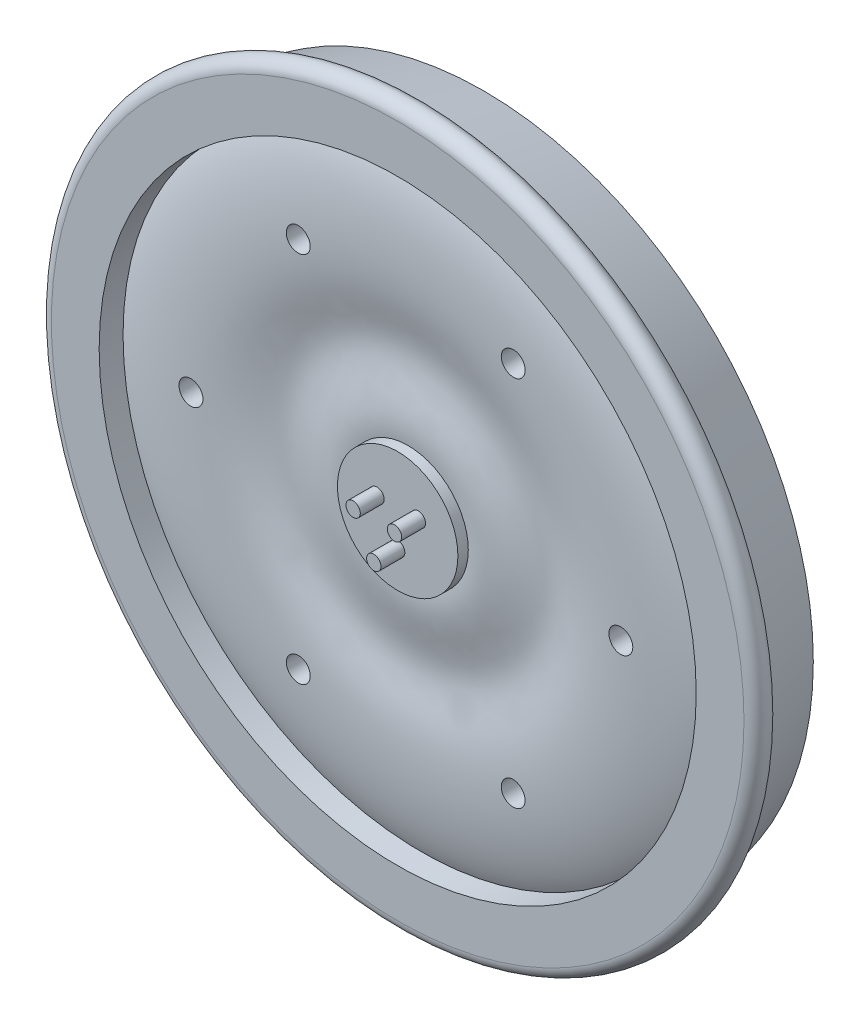
from build123d import *

# Parameters (mm, degrees)
SKETCH1_R           = 750
SKETCH1_R_2         = 625
BOSS_EXTRUDE1_DEPTH = 50
FILLET1_R           = 25
SKETCH6_R           = 126.083182062
BOSS_EXTRUDE3_DEPTH = 50
SKETCH8_R           = 15
BOSS_EXTRUDE4_DEPTH = 50
CIRPATTERN1_COUNT   = 3
SKETCH9_W           = 12.905989232
SKETCH9_H           = 4
BOSS_EXTRUDE5_DEPTH = 8
CIRPATTERN2_COUNT   = 9
SKETCH10_W          = 45.282032302
SKETCH10_H          = 16
BOSS_EXTRUDE6_DEPTH = 10
CIRPATTERN3_COUNT   = 6
CUT_EXTRUDE1_REACH  = 1087.311
SKETCH11_R          = 25
CIRPATTERN4_COUNT   = 3


with BuildPart() as part:
    # Sketch1 → Boss-Extrude1 (new body)
    with BuildSketch(Plane.XY):
        Circle(SKETCH1_R)
        Circle(SKETCH1_R_2, mode=Mode.SUBTRACT)
    extrude(amount=BOSS_EXTRUDE1_DEPTH)

    # Fillet1
    fillet1_edges = [part.edges().sort_by_distance(p)[0] for p in [
        (-750, 0, 0),
        (-750, 0, 50),
    ]]
    fillet(fillet1_edges, radius=FILLET1_R - 0.0001)  # a hair under: the kernel refuses the full size

    # Sketch4 → Revolve2 (revolve)
    with BuildSketch(Plane(origin=(0, 0, 0), x_dir=(0, 0, -1), z_dir=(1, 0, 0))):
        with BuildLine():
            Line((0, 0), (0, 725))
            Line((0, 725), (130, 690.166604984))
            Line((130, 690.166604984), (130, 540.166604984))
            Line((130, 540.166604984), (100.005783174, 540.166604984))
            add(Edge.make_bspline(
                [(100.005783174, 540.166604984), (96.198999511, 512.609594068), (86.026369645, 445.238818447), (114.230387903, 352.883317745), (111.02102964, 268.940515239), (91.251843551, 235.11912262), (100.273716459, 161.686724431), (105.684554179, 140.642715603)],
                knots=[0.05114988, 0.05114988, 0.05114988, 0.05114988, 0.227446797, 0.329786864, 0.370281134, 0.632389501, 0.754577815, 0.754577815, 0.754577815, 0.754577815], degree=3))
            ThreePointArc((105.684554179, 140.642715603), (108.527478552, 134.937725496), (114.755989065, 133.583182062))
            ThreePointArc((114.755989065, 133.583182062), (120.059289923, 131.38648292), (122.255989065, 126.083182062))
            Line((122.255989065, 126.083182062), (122.255989065, 0))
            Line((122.255989065, 0), (0, 0))
        make_face()
    revolve(axis=Axis((0, 0, -122.255989065), (0, 0, 1)))

    # Sketch6 → Boss-Extrude3 (add)
    with BuildSketch(Plane.XY):
        Circle(SKETCH6_R)
    extrude(amount=BOSS_EXTRUDE3_DEPTH)

    # Sketch7 → Revolve3 (revolve)
    with BuildSketch(Plane(origin=(0, 0, 0), x_dir=(0, 0, -1), z_dir=(1, 0, 0)), mode=Mode.PRIVATE) as revolve3_sk:
        with BuildLine():
            Line((-29.596042796, 0), (29.907052347, 0))
            Line((29.907052347, 0), (29.907052347, 625))
            Line((29.907052347, 625), (0, 625))
            add(Edge.make_bspline(
                [(0, 625), (-31.984047943, 561.665565463), (-43.874826253, 379.643970413), (10.233772598, 276.143642462), (-54.885565603, 132.651755512), (1.648232243, 44.929934245), (-29.596042796, 0)],
                knots=[0, 0, 0, 0, 0.281537496, 0.495292394, 0.717767116, 1, 1, 1, 1], degree=3))
        make_face()
    revolve(revolve3_sk.sketch.rotate(Axis((0, 0, 29.596042796), (0, 0, -1)), 90), axis=Axis((0, 0, 29.596042796), (0, 0, -1)))

    # Sketch8 → Boss-Extrude4 (add)
    with BuildSketch(Plane.XY.offset(50)):
        with Locations((0, -50)):
            Circle(SKETCH8_R)
    boss_extrude4 = extrude(amount=BOSS_EXTRUDE4_DEPTH)

    # CirPattern1: Boss-Extrude4 ×3 about axis
    cirpattern1_axis = Axis((0, 0, 0), (0, 0, 1))
    for i in range(1, CIRPATTERN1_COUNT):
        add(boss_extrude4.rotate(cirpattern1_axis, i * 360 / CIRPATTERN1_COUNT))

    # Sketch9 → Boss-Extrude5 (add)
    with BuildSketch(Plane(origin=(0, 0, -122.255989065), x_dir=(-1, 0, 0), z_dir=(0, 0, -1))):
        Polygon((11.547005384, -103.966096475), (5.773502692, -93.966096475), (-5.773502692, -93.966096475), (-11.547005384, -103.966096475), (-5.773502692, -113.966096475), (5.773502692, -113.966096475), align=None)
        with Locations((0, -103.966096475)):
            Rectangle(SKETCH9_W, SKETCH9_H, mode=Mode.SUBTRACT)
    boss_extrude5 = extrude(amount=BOSS_EXTRUDE5_DEPTH)

    # CirPattern2: Boss-Extrude5 ×9 about axis
    cirpattern2_axis = Axis((0, 0, 0), (0, 0, 1))
    for i in range(1, CIRPATTERN2_COUNT):
        add(boss_extrude5.rotate(cirpattern2_axis, i * 360 / CIRPATTERN2_COUNT))

    # Sketch10 → Boss-Extrude6 (add)
    with BuildSketch(Plane(origin=(0, 0, -130), x_dir=(-1, 0, 0), z_dir=(0, 0, -1))):
        Polygon((34.641016151, -625.324794125), (17.320508076, -595.324794125), (-17.320508076, -595.324794125), (-34.641016151, -625.324794125), (-17.320508076, -655.324794125), (17.320508076, -655.324794125), align=None)
        with Locations((0, -625.324794125)):
            Rectangle(SKETCH10_W, SKETCH10_H, mode=Mode.SUBTRACT)
    boss_extrude6 = extrude(amount=BOSS_EXTRUDE6_DEPTH)

    # CirPattern3: Boss-Extrude6 ×6 about axis
    cirpattern3_axis = Axis((0, 0, 0), (0, 0, 1))
    for i in range(1, CIRPATTERN3_COUNT):
        add(boss_extrude6.rotate(cirpattern3_axis, i * 360 / CIRPATTERN3_COUNT))

    # Sketch11 → Cut-Extrude1 (cut, up to next)
    with BuildSketch(Plane(origin=(0, 0, -130), x_dir=(-1, 0, 0), z_dir=(0, 0, -1)), mode=Mode.PRIVATE) as cut_extrude1_sk1:
        with Locations(Location((450, 0, 0), (0, 0, 90))):
            Circle(SKETCH11_R)
    cut_extrude1_tool1 = extrude(cut_extrude1_sk1.sketch, amount=-CUT_EXTRUDE1_REACH, mode=Mode.PRIVATE) & part.part
    # Sketch11 → Cut-Extrude1 (cut, up to next)
    with BuildSketch(Plane(origin=(0, 0, -130), x_dir=(-1, 0, 0), z_dir=(0, 0, -1)), mode=Mode.PRIVATE) as cut_extrude1_sk2:
        with Locations(Location((-450, 0, 0), (0, 0, 90))):
            Circle(SKETCH11_R)
    cut_extrude1_tool2 = extrude(cut_extrude1_sk2.sketch, amount=-CUT_EXTRUDE1_REACH, mode=Mode.PRIVATE) & part.part
    cut_extrude1_1 = cut_extrude1_tool1.solids().sort_by_distance((-450, 0, -130))[0]
    add(cut_extrude1_1, mode=Mode.SUBTRACT)
    cut_extrude1_2 = cut_extrude1_tool2.solids().sort_by_distance((450, 0, -130))[0]
    add(cut_extrude1_2, mode=Mode.SUBTRACT)
    cut_extrude1 = cut_extrude1_1 + cut_extrude1_2  # Cut-Extrude1 as one shape, for the pattern or mirror that repeats it

    # CirPattern4: Cut-Extrude1 ×3 about axis
    cirpattern4_axis = Axis((0, 0, 0), (0, 0, 1))
    for i in range(1, CIRPATTERN4_COUNT):
        add(cut_extrude1.rotate(cirpattern4_axis, i * 360 / CIRPATTERN4_COUNT), mode=Mode.SUBTRACT)


solid = part.part
